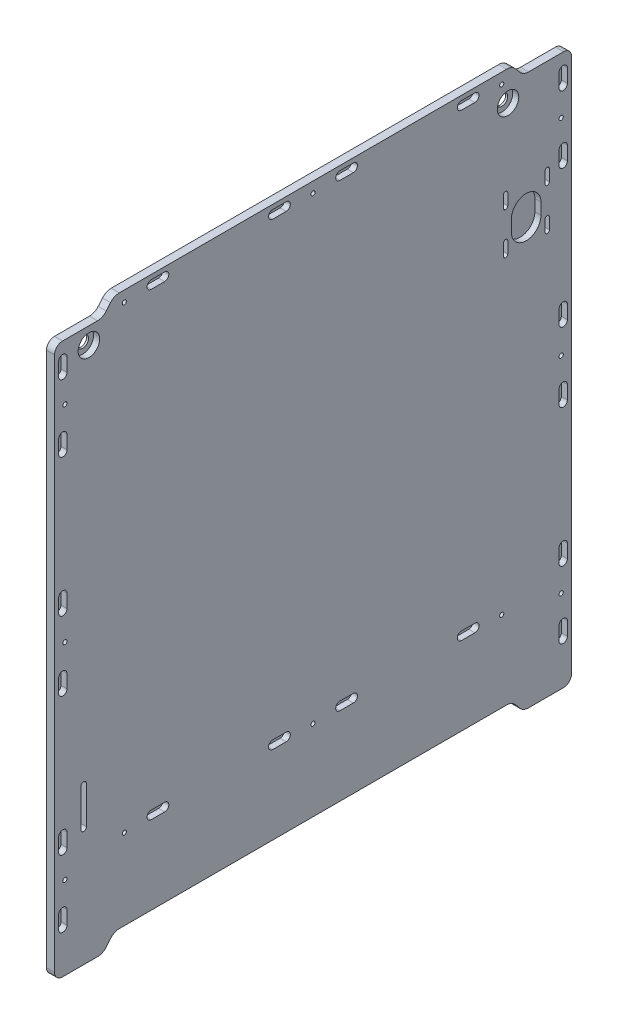
from build123d import *

# Parameters (mm, degrees)
CROQUIS1_R              = 4.25
CROQUIS1_R_2            = 1.55
CROQUIS1_R_3            = 1.6
SALIENTE_EXTRUIR1_DEPTH = 6
CROQUIS3_R              = 8
CORTAR_EXTRUIR1_DEPTH   = 4.5
CHAFL_N1_SIZE           = 1.5
CORTAR_EXTRUIR2_DEPTH   = 6


with BuildPart() as part:
    # Croquis1 → Saliente-Extruir1 (new body)
    with BuildSketch(Plane(origin=(0, 0, 0), x_dir=(0, 0, -1), z_dir=(1, 0, 0))):
        with BuildLine():
            Line((138.549019323, -203.054493985), (135.2532588, -199.126759542))
            ThreePointArc((135.2532588, -199.126759542), (132.334136258, -196.886838034), (128.741881033, -196.090454224))
            Line((128.741881033, -196.090454224), (-159.54831728, -196.090454224))
            ThreePointArc((-159.54831728, -196.090454224), (-163.140572505, -196.886838034), (-166.059695047, -199.126759542))
            Line((-166.059695047, -199.126759542), (-169.355455569, -203.054493985))
            ThreePointArc((-169.355455569, -203.054493985), (-172.274578058, -205.294415452), (-175.866833217, -206.090799248))
            Line((-175.866833217, -206.090799248), (-201.903218123, -206.090799248))
            ThreePointArc((-201.903218123, -206.090799248), (-206.14585881, -204.333439935), (-207.903218123, -200.090799248))
            Line((-207.903218123, -200.090799248), (-207.903218123, 198.006904316))
            ThreePointArc((-207.903218123, 198.006904316), (-206.145858831, 202.249545024), (-201.903218123, 204.006904345))
            Line((-201.903218123, 204.006904345), (-175.90321816, 204.006904345))
            ThreePointArc((-175.90321816, 204.006904345), (-172.310962954, 204.803288151), (-169.391840427, 207.043209647))
            Line((-169.391840427, 207.043209647), (-166.178352412, 210.872895533))
            ThreePointArc((-166.178352412, 210.872895533), (-163.259229966, 213.112816968), (-159.666974858, 213.909200752))
            Line((-159.666974858, 213.909200752), (128.860538611, 213.909200752))
            ThreePointArc((128.860538611, 213.909200752), (132.452793719, 213.112816968), (135.371916166, 210.872895533))
            Line((135.371916166, 210.872895533), (138.585404181, 207.043209647))
            ThreePointArc((138.585404181, 207.043209647), (141.504526707, 204.803288151), (145.096781914, 204.006904345))
            Line((145.096781914, 204.006904345), (171.096781877, 204.006904345))
            ThreePointArc((171.096781877, 204.006904345), (175.339422584, 202.249545024), (177.096781877, 198.006904316))
            Line((177.096781877, 198.006904316), (177.096781877, -200.090799248))
            ThreePointArc((177.096781877, -200.090799248), (175.339422564, -204.333439935), (171.096781877, -206.090799248))
            Line((171.096781877, -206.090799248), (145.060396971, -206.090799248))
            ThreePointArc((145.060396971, -206.090799248), (141.468141811, -205.294415452), (138.549019323, -203.054493985))
        make_face()
        with Locations((-182.303218123, 191.506904345)):
            Circle(CROQUIS1_R, mode=Mode.SUBTRACT)
        with Locations((129.796781877, 191.506904345)):
            Circle(CROQUIS1_R, mode=Mode.SUBTRACT)
        with Locations((-15.403218123, 205.909200752)):
            Circle(CROQUIS1_R_2, mode=Mode.SUBTRACT)
        with Locations((125.096781877, 205.909200752)):
            Circle(CROQUIS1_R_2, mode=Mode.SUBTRACT)
        with Locations((-155.903218123, 205.909200752)):
            Circle(CROQUIS1_R_2, mode=Mode.SUBTRACT)
        with Locations((-15.403218123, -136.090799248)):
            Circle(CROQUIS1_R_2, mode=Mode.SUBTRACT)
        with Locations((125.096781877, -136.090799248)):
            Circle(CROQUIS1_R_2, mode=Mode.SUBTRACT)
        with Locations((-155.903218123, -136.090799248)):
            Circle(CROQUIS1_R_2, mode=Mode.SUBTRACT)
        with Locations((-200.153218123, 162.206904345)):
            Circle(CROQUIS1_R_3, mode=Mode.SUBTRACT)
        with Locations((-200.153218123, 8.909373264)):
            Circle(CROQUIS1_R_3, mode=Mode.SUBTRACT)
        with Locations((-200.153218123, -144.388157817)):
            Circle(CROQUIS1_R_3, mode=Mode.SUBTRACT)
        with Locations((169.346781877, -144.388157817)):
            Circle(CROQUIS1_R_3, mode=Mode.SUBTRACT)
        with Locations((169.346781877, 8.909373264)):
            Circle(CROQUIS1_R_3, mode=Mode.SUBTRACT)
        with Locations((169.346781877, 162.206904345)):
            Circle(CROQUIS1_R_3, mode=Mode.SUBTRACT)
        with BuildLine():
            Line((126.396781877, 133.909200752), (126.396781877, 125.409200752))
            ThreePointArc((126.396781877, 125.409200752), (127.996781877, 123.809200752), (129.596781877, 125.409200752))
            Line((129.596781877, 125.409200752), (129.596781877, 133.909200752))
            ThreePointArc((129.596781877, 133.909200752), (127.996781877, 135.509200752), (126.396781877, 133.909200752))
        make_face(mode=Mode.SUBTRACT)
        with BuildLine():
            Line((157.396781877, 133.909200752), (157.396781877, 125.409200752))
            ThreePointArc((157.396781877, 125.409200752), (158.996781877, 123.809200752), (160.596781877, 125.409200752))
            Line((160.596781877, 125.409200752), (160.596781877, 133.909200752))
            ThreePointArc((160.596781877, 133.909200752), (158.996781877, 135.509200752), (157.396781877, 133.909200752))
        make_face(mode=Mode.SUBTRACT)
        with BuildLine():
            Line((157.396781877, 102.909200752), (157.396781877, 94.409200752))
            ThreePointArc((157.396781877, 94.409200752), (158.996781877, 92.809200752), (160.596781877, 94.409200752))
            Line((160.596781877, 94.409200752), (160.596781877, 102.909200752))
            ThreePointArc((160.596781877, 102.909200752), (158.996781877, 104.509200752), (157.396781877, 102.909200752))
        make_face(mode=Mode.SUBTRACT)
        with BuildLine():
            Line((126.396781877, 102.909200752), (126.396781877, 94.409200752))
            ThreePointArc((126.396781877, 94.409200752), (127.996781877, 92.809200752), (129.596781877, 94.409200752))
            Line((129.596781877, 94.409200752), (129.596781877, 102.909200752))
            ThreePointArc((129.596781877, 102.909200752), (127.996781877, 104.509200752), (126.396781877, 102.909200752))
        make_face(mode=Mode.SUBTRACT)
    extrude(amount=SALIENTE_EXTRUIR1_DEPTH)

    # Croquis3 → Cortar-Extruir1 (cut)
    with BuildSketch(Plane(origin=(6, 0, 0), x_dir=(0, 0, -1), z_dir=(1, 0, 0))):
        with Locations((-182.303218123, 191.506904345)):
            Circle(CROQUIS3_R)
        with Locations((129.796781877, 191.506904345)):
            Circle(CROQUIS3_R)
        with BuildLine():
            Line((132.296781877, 115.506904345), (132.296781877, 107.006904345))
            ThreePointArc((132.296781877, 107.006904345), (143.296781877, 96.006904345), (154.296781877, 107.006904345))
            Line((154.296781877, 107.006904345), (154.296781877, 115.506904345))
            ThreePointArc((154.296781877, 115.506904345), (143.296781877, 126.506904345), (132.296781877, 115.506904345))
        make_face()
        with BuildLine():
            Line((-198.603218123, 192.206904345), (-198.603218123, 182.206904345))
            ThreePointArc((-198.603218123, 182.206904345), (-201.703218123, 179.106904345), (-204.803218123, 182.206904345))
            Line((-204.803218123, 182.206904345), (-204.803218123, 192.206904345))
            ThreePointArc((-204.803218123, 192.206904345), (-201.703218123, 195.306904345), (-198.603218123, 192.206904345))
        make_face()
        with BuildLine():
            Line((-198.603218123, 142.206904345), (-198.603218123, 132.206904345))
            ThreePointArc((-198.603218123, 132.206904345), (-201.703218123, 129.106904345), (-204.803218123, 132.206904345))
            Line((-204.803218123, 132.206904345), (-204.803218123, 142.206904345))
            ThreePointArc((-204.803218123, 142.206904345), (-201.703218123, 145.306904345), (-198.603218123, 142.206904345))
        make_face()
        with BuildLine():
            Line((-198.603218123, -124.388157817), (-198.603218123, -114.388157817))
            ThreePointArc((-198.603218123, -114.388157817), (-201.703218123, -111.288157817), (-204.803218123, -114.388157817))
            Line((-204.803218123, -114.388157817), (-204.803218123, -124.388157817))
            ThreePointArc((-204.803218123, -124.388157817), (-201.703218123, -127.488157817), (-198.603218123, -124.388157817))
        make_face()
        with BuildLine():
            Line((-204.803218123, -174.388157817), (-204.803218123, -164.388157817))
            ThreePointArc((-204.803218123, -164.388157817), (-201.703218123, -161.288157817), (-198.603218123, -164.388157817))
            Line((-198.603218123, -164.388157817), (-198.603218123, -174.388157817))
            ThreePointArc((-198.603218123, -174.388157817), (-201.703218123, -177.488157817), (-204.803218123, -174.388157817))
        make_face()
        with BuildLine():
            Line((-198.603218123, 39.767139749), (-198.603218123, 29.767139749))
            ThreePointArc((-198.603218123, 29.767139749), (-201.703218123, 26.667139749), (-204.803218123, 29.767139749))
            Line((-204.803218123, 29.767139749), (-204.803218123, 39.767139749))
            ThreePointArc((-204.803218123, 39.767139749), (-201.703218123, 42.867139749), (-198.603218123, 39.767139749))
        make_face()
        with BuildLine():
            Line((-198.603218123, -11.94839322), (-198.603218123, -21.94839322))
            ThreePointArc((-198.603218123, -21.94839322), (-201.703218123, -25.04839322), (-204.803218123, -21.94839322))
            Line((-204.803218123, -21.94839322), (-204.803218123, -11.94839322))
            ThreePointArc((-204.803218123, -11.94839322), (-201.703218123, -8.84839322), (-198.603218123, -11.94839322))
        make_face()
        with BuildLine():
            Line((167.796781877, -174.388157817), (167.796781877, -164.388157817))
            ThreePointArc((167.796781877, -164.388157817), (170.896781877, -161.288157817), (173.996781877, -164.388157817))
            Line((173.996781877, -164.388157817), (173.996781877, -174.388157817))
            ThreePointArc((173.996781877, -174.388157817), (170.896781877, -177.488157817), (167.796781877, -174.388157817))
        make_face()
        with BuildLine():
            Line((173.996781877, -124.388157817), (173.996781877, -114.388157817))
            ThreePointArc((173.996781877, -114.388157817), (170.896781877, -111.288157817), (167.796781877, -114.388157817))
            Line((167.796781877, -114.388157817), (167.796781877, -124.388157817))
            ThreePointArc((167.796781877, -124.388157817), (170.896781877, -127.488157817), (173.996781877, -124.388157817))
        make_face()
        with BuildLine():
            Line((173.996781877, -11.94839322), (173.996781877, -21.94839322))
            ThreePointArc((173.996781877, -21.94839322), (170.896781877, -25.04839322), (167.796781877, -21.94839322))
            Line((167.796781877, -21.94839322), (167.796781877, -11.94839322))
            ThreePointArc((167.796781877, -11.94839322), (170.896781877, -8.84839322), (173.996781877, -11.94839322))
        make_face()
        with BuildLine():
            Line((173.996781877, 39.767139749), (173.996781877, 29.767139749))
            ThreePointArc((173.996781877, 29.767139749), (170.896781877, 26.667139749), (167.796781877, 29.767139749))
            Line((167.796781877, 29.767139749), (167.796781877, 39.767139749))
            ThreePointArc((167.796781877, 39.767139749), (170.896781877, 42.867139749), (173.996781877, 39.767139749))
        make_face()
        with BuildLine():
            Line((-45.403218123, 210.509200752), (-35.403218123, 210.509200752))
            ThreePointArc((-35.403218123, 210.509200752), (-32.303218123, 207.409200752), (-35.403218123, 204.309200752))
            Line((-35.403218123, 204.309200752), (-45.403218123, 204.309200752))
            ThreePointArc((-45.403218123, 204.309200752), (-48.503218123, 207.409200752), (-45.403218123, 210.509200752))
        make_face()
        with BuildLine():
            Line((-135.903218123, 210.509200752), (-125.903218123, 210.509200752))
            ThreePointArc((-125.903218123, 210.509200752), (-122.803218123, 207.409200752), (-125.903218123, 204.309200752))
            Line((-125.903218123, 204.309200752), (-135.903218123, 204.309200752))
            ThreePointArc((-135.903218123, 204.309200752), (-139.003218123, 207.409200752), (-135.903218123, 210.509200752))
        make_face()
        with BuildLine():
            Line((105.096781877, 204.309200752), (95.096781877, 204.309200752))
            ThreePointArc((95.096781877, 204.309200752), (91.996781877, 207.409200752), (95.096781877, 210.509200752))
            Line((95.096781877, 210.509200752), (105.096781877, 210.509200752))
            ThreePointArc((105.096781877, 210.509200752), (108.196781877, 207.409200752), (105.096781877, 204.309200752))
        make_face()
        with BuildLine():
            Line((14.596781877, 204.309200752), (4.596781877, 204.309200752))
            ThreePointArc((4.596781877, 204.309200752), (1.496781877, 207.409200752), (4.596781877, 210.509200752))
            Line((4.596781877, 210.509200752), (14.596781877, 210.509200752))
            ThreePointArc((14.596781877, 210.509200752), (17.696781877, 207.409200752), (14.596781877, 204.309200752))
        make_face()
        with BuildLine():
            Line((-135.903218123, -131.490799248), (-125.903218123, -131.490799248))
            ThreePointArc((-125.903218123, -131.490799248), (-122.803218123, -134.590799248), (-125.903218123, -137.690799248))
            Line((-125.903218123, -137.690799248), (-135.903218123, -137.690799248))
            ThreePointArc((-135.903218123, -137.690799248), (-139.003218123, -134.590799248), (-135.903218123, -131.490799248))
        make_face()
        with BuildLine():
            Line((-45.403218123, -131.490799248), (-35.403218123, -131.490799248))
            ThreePointArc((-35.403218123, -131.490799248), (-32.303218123, -134.590799248), (-35.403218123, -137.690799248))
            Line((-35.403218123, -137.690799248), (-45.403218123, -137.690799248))
            ThreePointArc((-45.403218123, -137.690799248), (-48.503218123, -134.590799248), (-45.403218123, -131.490799248))
        make_face()
        with BuildLine():
            Line((14.596781877, -131.490799248), (4.596781877, -131.490799248))
            ThreePointArc((4.596781877, -131.490799248), (1.496781877, -134.590799248), (4.596781877, -137.690799248))
            Line((4.596781877, -137.690799248), (14.596781877, -137.690799248))
            ThreePointArc((14.596781877, -137.690799248), (17.696781877, -134.590799248), (14.596781877, -131.490799248))
        make_face()
        with BuildLine():
            Line((105.096781877, -131.490799248), (95.096781877, -131.490799248))
            ThreePointArc((95.096781877, -131.490799248), (91.996781877, -134.590799248), (95.096781877, -137.690799248))
            Line((95.096781877, -137.690799248), (105.096781877, -137.690799248))
            ThreePointArc((105.096781877, -137.690799248), (108.196781877, -134.590799248), (105.096781877, -131.490799248))
        make_face()
        with BuildLine():
            Line((173.996781877, 142.206904345), (173.996781877, 132.206904345))
            ThreePointArc((173.996781877, 132.206904345), (170.896781877, 129.106904345), (167.796781877, 132.206904345))
            Line((167.796781877, 132.206904345), (167.796781877, 142.206904345))
            ThreePointArc((167.796781877, 142.206904345), (170.896781877, 145.306904345), (173.996781877, 142.206904345))
        make_face()
        with BuildLine():
            Line((173.996781877, 192.206904345), (173.996781877, 182.206904345))
            ThreePointArc((173.996781877, 182.206904345), (170.896781877, 179.106904345), (167.796781877, 182.206904345))
            Line((167.796781877, 182.206904345), (167.796781877, 192.206904345))
            ThreePointArc((167.796781877, 192.206904345), (170.896781877, 195.306904345), (173.996781877, 192.206904345))
        make_face()
    extrude(amount=-CORTAR_EXTRUIR1_DEPTH, mode=Mode.SUBTRACT)

    # Chaflán1
    chafl_n1_edges = [part.edges().sort_by_distance(p)[0] for p in [
        (0, 205.909200752, 16.953218123),
        (0, 205.909200752, -123.546781877),
        (0, -136.090799248, -123.546781877),
        (0, -136.090799248, 16.953218123),
        (0, -136.090799248, 157.453218123),
        (0, 162.206904345, 201.753218123),
        (0, 205.909200752, 157.453218123),
        (0, 162.206904345, -167.746781877),
        (0, 8.909373264, -167.746781877),
        (0, -144.388157817, -167.746781877),
        (0, -144.388157817, 201.753218123),
        (0, 8.909373264, 201.753218123),
    ]]
    chamfer(chafl_n1_edges, length=CHAFL_N1_SIZE)

    # Croquis4 → Cortar-Extruir2 (cut)
    with BuildSketch(Plane.ZY):
        with BuildLine():
            Line((184.156655118, -118.090799248), (184.156655118, -90.056181538))
            ThreePointArc((184.156655118, -90.056181538), (186.200240965, -88.012595692), (188.243826812, -90.056181538))
            Line((188.243826812, -90.056181538), (188.243826812, -118.090799248))
            ThreePointArc((188.243826812, -118.090799248), (186.200240965, -120.134385094), (184.156655118, -118.090799248))
        make_face()
    extrude(amount=-CORTAR_EXTRUIR2_DEPTH, mode=Mode.SUBTRACT)


solid = part.part
